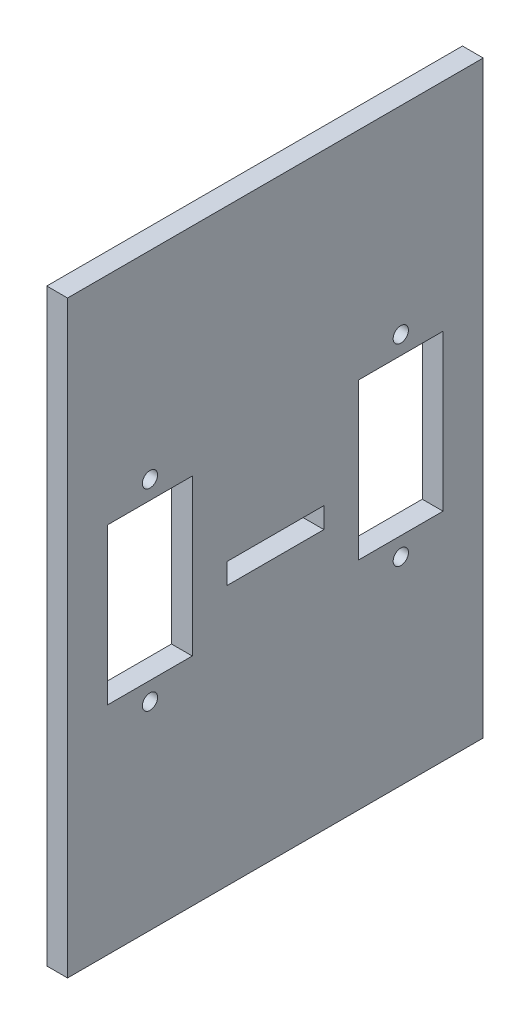
from build123d import *

# Parameters (mm, degrees)
SKETCH1_W           = 60
SKETCH1_H           = 85
SKETCH1_R           = 1.1
SKETCH1_W_2         = 12.2
SKETCH1_H_2         = 22.5
BOSS_EXTRUDE1_DEPTH = 3
SKETCH2_W           = 14
SKETCH2_H           = 3
CUT_EXTRUDE1_DEPTH  = 3


with BuildPart() as part:
    # Sketch1 → Boss-Extrude1 (new body)
    with BuildSketch(Plane(origin=(0, 0, 0), x_dir=(0, 0, -1), z_dir=(1, 0, 0))):
        Rectangle(SKETCH1_W, SKETCH1_H)
        with Locations((18.1, 13.9)):
            Circle(SKETCH1_R, mode=Mode.SUBTRACT)
        with Locations((18.1, -13.9)):
            Circle(SKETCH1_R, mode=Mode.SUBTRACT)
        with Locations((-18.1, -13.9)):
            Circle(SKETCH1_R, mode=Mode.SUBTRACT)
        with Locations((-18.1, 13.9)):
            Circle(SKETCH1_R, mode=Mode.SUBTRACT)
        with Locations((18.1, 0)):
            Rectangle(SKETCH1_W_2, SKETCH1_H_2, mode=Mode.SUBTRACT)
        with Locations((-18.1, 0)):
            Rectangle(SKETCH1_W_2, SKETCH1_H_2, mode=Mode.SUBTRACT)
    extrude(amount=BOSS_EXTRUDE1_DEPTH)

    # Sketch2 → Cut-Extrude1 (cut)
    with BuildSketch(Plane(origin=(3, 0, 0), x_dir=(0, 0, -1), z_dir=(1, 0, 0))):
        with Locations((0, -3.45)):
            Rectangle(SKETCH2_W, SKETCH2_H)
    extrude(amount=-CUT_EXTRUDE1_DEPTH, mode=Mode.SUBTRACT)


solid = part.part
